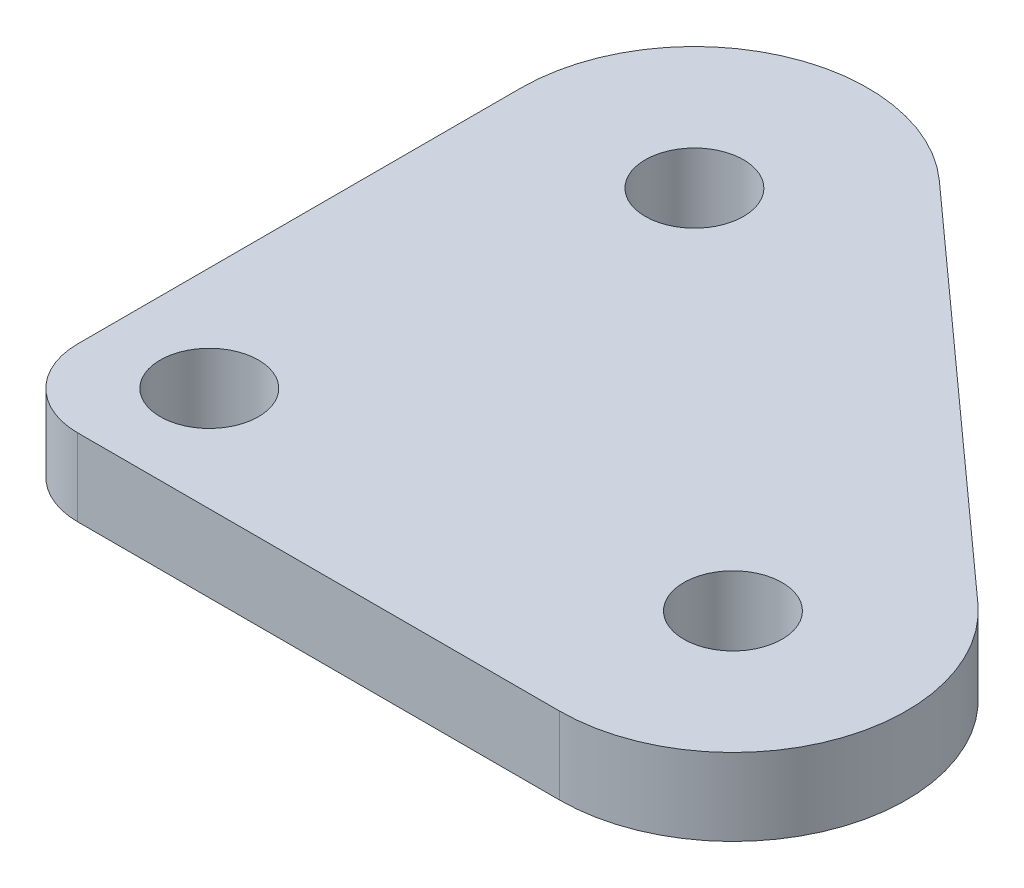
from build123d import *

# Parameters (mm, degrees)
SKETCH1_R           = 2.55
BOSS_EXTRUDE1_DEPTH = 4
FILLET1_R           = 4
SKETCH2_R           = 2.55
CUT_EXTRUDE1_DEPTH  = 4


with BuildPart() as part:
    # Sketch1 → Boss-Extrude1 (new body)
    with BuildSketch(Plane(origin=(0, 0, 0), x_dir=(1, 0, 0), z_dir=(0, 1, 0))):
        with BuildLine():
            ThreePointArc((6.020682585, 24.689647316), (-3.661547264, 26.22150057), (-9, 18))
            Line((-9, 18), (-9, -9))
            Line((-9, -9), (20, -9))
            ThreePointArc((20, -9), (28.402583705, -3.224373905), (26.020682585, 6.689647316))
            Line((26.020682585, 6.689647316), (6.020682585, 24.689647316))
        make_face()
        with Locations((0, 18)):
            Circle(SKETCH1_R, mode=Mode.SUBTRACT)
        with Locations((20, 0)):
            Circle(SKETCH1_R, mode=Mode.SUBTRACT)
    extrude(amount=BOSS_EXTRUDE1_DEPTH)

    # Fillet1
    fillet1_edges = [part.edges().sort_by_distance(p)[0] for p in [
        (-9, 2, 9),
    ]]
    fillet(fillet1_edges, radius=FILLET1_R)

    # Sketch2 → Cut-Extrude1 (cut)
    with BuildSketch(Plane.XZ):
        with Locations((-3.585786438, 3.585786438)):
            Circle(SKETCH2_R)
    extrude(amount=-CUT_EXTRUDE1_DEPTH, mode=Mode.SUBTRACT)


solid = part.part
